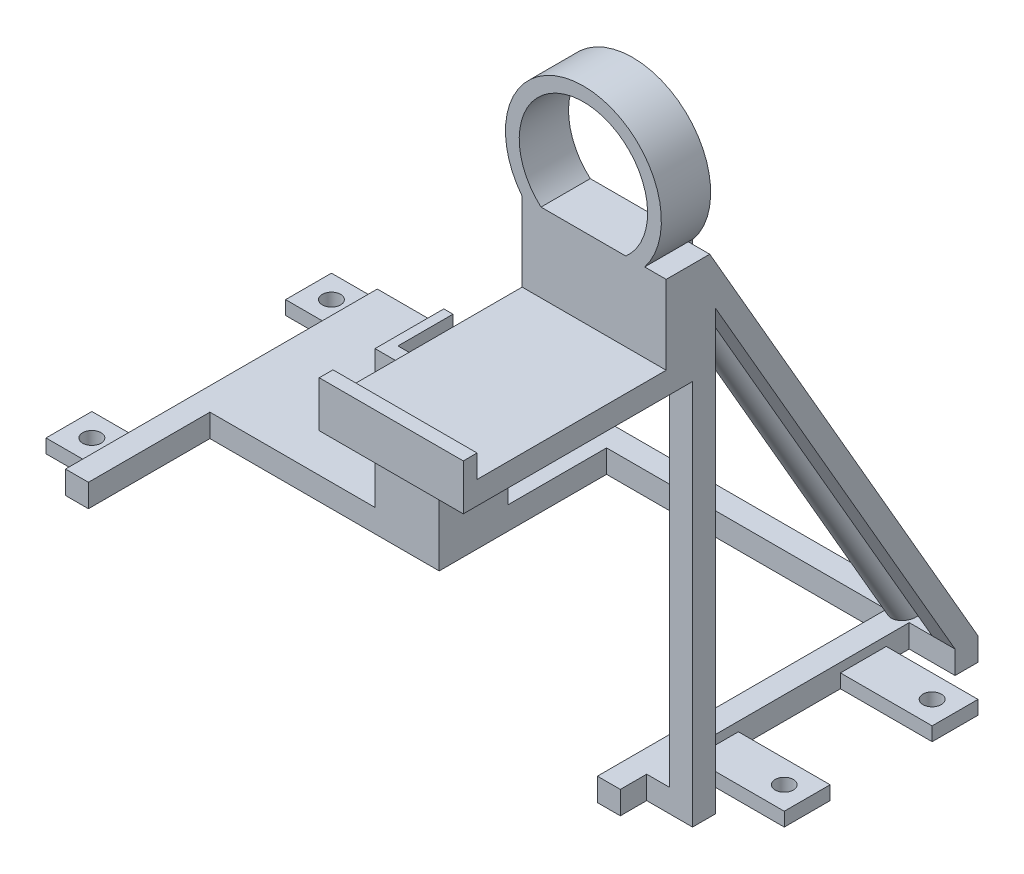
from build123d import *
from OCP.BRepAlgoAPI import BRepAlgoAPI_Cut
from OCP.TopTools import TopTools_ListOfShape

# Parameters (mm, degrees)
BOSS_EXTRUDE1_DEPTH              = 5
SKETCH2_R                        = 2.5
BOSS_EXTRUDE2_DEPTH              = 100
SKETCH3_W                        = 5
SKETCH3_H                        = 5
BOSS_EXTRUDE3_DEPTH              = 10
SKETCH5_W                        = 5
SKETCH5_H                        = 4.330127019
BOSS_EXTRUDE4_DEPTH              = 117
SKETCH6_W                        = 5
SKETCH6_H                        = 5
BOSS_EXTRUDE5_DEPTH              = 20
BOSS_EXTRUDE6_DEPTH              = 15
SKETCH9_W                        = 5
SKETCH9_H                        = 5
BOSS_EXTRUDE7_DEPTH              = 10
SKETCH10_W                       = 5
SKETCH10_H                       = 5
BOSS_EXTRUDE8_DEPTH              = 99.159909
SKETCH11_W                       = 10
SKETCH11_H                       = 3
BOSS_EXTRUDE9_DEPTH              = 10
CUT_EXTRUDE1_DEPTH               = 187.084790711
CUT_EXTRUDE1_DEPTH_BACK          = 187.084790711
SKETCH13_R                       = 2
SKETCH14_W                       = 10
SKETCH14_H                       = 3
BOSS_EXTRUDE10_DEPTH             = 20
CUT_EXTRUDE2_DEPTH               = 194.255140511
CUT_EXTRUDE2_DEPTH_BACK          = 194.255140511
SKETCH15_R                       = 2
BOSS_EXTRUDE11_DEPTH             = 7.8
CUT_EXTRUDE3_DEPTH               = 187.016127587
CUT_EXTRUDE3_DEPTH_BACK          = 187.016127587
SKETCH17_W                       = 22.17902444
SKETCH17_H                       = 20
BOSS_EXTRUDE12_DEPTH             = 5.75
BOSS_EXTRUDE12_DEPTH_BACK        = 5
SKETCH19_W                       = 1.5
SKETCH19_H                       = 10.75
BOSS_EXTRUDE13_DEPTH             = 2.742414
SKETCH21_W                       = 1.5
SKETCH21_H                       = 1
BOSS_EXTRUDE15_DEPTH             = 1
BOSS_EXTRUDE17_REACH             = 195.512
CUT_EXTRUDE4_START               = 2
SKETCH23_W                       = 7.8
SKETCH23_H                       = 12
CUT_EXTRUDE4_DEPTH               = 10
BOSS_EXTRUDE19_DEPTH             = 5
BOSS_EXTRUDE19_DEPTH_BACK        = 2.165064
SKETCH23_2_W                     = 7.8
SKETCH23_2_H                     = 12
CUT_EXTRUDE5_DEPTH               = 1.25
BOSS_EXTRUDE20_REACH             = 188.016
SKETCH25_W                       = 5
SKETCH25_H                       = 4.330127019
SKETCH26_W                       = 5
SKETCH26_H                       = 2.16506351
CUT_EXTRUDE6_DEPTH               = 5
SKETCH27_W                       = 5.75
SKETCH27_H                       = 7.16506351
BOSS_EXTRUDE21_DEPTH             = 5
SKETCH29_W                       = 3
SKETCH29_H                       = 30
BOSS_EXTRUDE22_DEPTH             = 55
SKETCH30_W                       = 5
SKETCH30_H                       = 3
BOSS_EXTRUDE23_DEPTH             = 5
SKETCH31_W                       = 5
SKETCH31_H                       = 5
BOSS_EXTRUDE24_DEPTH             = 33.5
SKETCH32_W                       = 2
SKETCH32_H                       = 19
BOSS_EXTRUDE25_DEPTH             = 12
SKETCH34_W                       = 41
SKETCH34_H                       = 3
CUT_EXTRUDE7_DEPTH               = 30
SKETCH35_W                       = 14
SKETCH35_H                       = 12
BOSS_EXTRUDE26_DEPTH             = 7
BOSS_EXTRUDE27_REACH             = 187.154
SKETCH36_W                       = 9
SKETCH36_H                       = 5
BOSS_EXTRUDE27_DIRECTION_2_REACH = 187.154
SKETCH37_W                       = 41.5
SKETCH37_H                       = 5
BOSS_EXTRUDE28_DEPTH             = 41
SKETCH38_W                       = 34.251665069
SKETCH38_H                       = 27.087918127
CUT_EXTRUDE8_DEPTH               = 185.330721404
SKETCH39_W                       = 67.684653824
SKETCH39_H                       = 30.030202731
CUT_EXTRUDE9_DEPTH               = 190.235302527
SKETCH44_W                       = 5
SKETCH44_H                       = 7.16506351
BOSS_EXTRUDE30_DEPTH             = 18.612596
BOSS_EXTRUDE31_DEPTH             = 10.75
BOSS_EXTRUDE32_DEPTH             = 5.75
SKETCH46_W                       = 5
SKETCH46_H                       = 5
EDIT_THIS_LENGTH_DEPTH           = 50
SKETCH47_W                       = 5
SKETCH47_H                       = 3
BOSS_EXTRUDE34_DEPTH             = 5
BOSS_EXTRUDE35_REACH             = 207.703
SKETCH48_W                       = 26.412596329
SKETCH48_H                       = 5.25
SKETCH50_W                       = 5
SKETCH50_H                       = 5.75
BOSS_EXTRUDE36_DEPTH             = 10
BOSS_EXTRUDE37_DEPTH             = 26.412596329
CHAMFER1_SIZE                    = 16
CHAMFER1_SIZE2                   = 1.399818616


with BuildPart() as part:
    # Sketch1 → Boss-Extrude1 (new body)
    with BuildSketch(Plane(origin=(0, 0, 0), x_dir=(1, 0, 0), z_dir=(0, 1, 0))):
        Polygon((121, 0), (0, 0), (0, -68), (5, -68), (5, -5), (116, -5), (116, -68), (121, -68), align=None)
    extrude(amount=BOSS_EXTRUDE1_DEPTH)

    # Sketch2 → Boss-Extrude2 (add)
    with BuildSketch(Plane(origin=(0, 3.75, 2.165063509), x_dir=(1, 0, 0), z_dir=(0, 0.866025403784438, 0.500000000000001))):
        with Locations(Location((118.200131686, -0.299868314, 0), (0, 0, 90))):
            Circle(SKETCH2_R)
    extrude(amount=BOSS_EXTRUDE2_DEPTH)

    # Sketch3 → Boss-Extrude3 (add)
    with BuildSketch(Plane(origin=(121, 0, 0), x_dir=(0, 0, -1), z_dir=(1, 0, 0))):
        with Locations((-2.5, 2.5)):
            Rectangle(SKETCH3_W, SKETCH3_H)
    extrude(amount=BOSS_EXTRUDE3_DEPTH)

    # Sketch5 → Boss-Extrude4 (add)
    with BuildSketch(Plane(origin=(0, 3.75, 2.165063509), x_dir=(1, 0, 0), z_dir=(0, 0.866025403784438, 0.500000000000001))):
        with Locations((128.5, 0.33493649)):
            Rectangle(SKETCH5_W, SKETCH5_H)
    extrude(amount=BOSS_EXTRUDE4_DEPTH)

    # Sketch6 → Boss-Extrude5 (add)
    with BuildSketch(Plane(origin=(0, 1.25, -2.165063509), x_dir=(-1, 0, 0), z_dir=(0, 0.5000000000000009, -0.866025403784438))):
        with Locations((-128.5, 118.830127019)):
            Rectangle(SKETCH6_W, SKETCH6_H)
    extrude(amount=BOSS_EXTRUDE5_DEPTH)

    # Sketch7 → Boss-Extrude6 (add)
    with BuildSketch(Plane.ZY.offset(-126)):
        Polygon((45.509618943, 113.824972243), (41.179491924, 116.324972243), (38.679491924, 111.994845224), (43.009618943, 109.494845224), align=None)
    extrude(amount=BOSS_EXTRUDE6_DEPTH)

    # Sketch9 → Boss-Extrude7 (add)
    with BuildSketch(Plane(origin=(121, 0, 0), x_dir=(0, 0, -1), z_dir=(1, 0, 0))):
        with Locations((-59.75, 2.5)):
            Rectangle(SKETCH9_W, SKETCH9_H)
    extrude(amount=BOSS_EXTRUDE7_DEPTH)

    # Sketch10 → Boss-Extrude8 (add)
    with BuildSketch(Plane(origin=(0, 5, 0), x_dir=(1, 0, 0), z_dir=(0, 1, 0))):
        with Locations((128.5, -59.75)):
            Rectangle(SKETCH10_W, SKETCH10_H)
    extrude(amount=BOSS_EXTRUDE8_DEPTH)

    # Sketch11 → Boss-Extrude9 (add)
    with BuildSketch(Plane.ZY):
        with Locations((57.25, 1.5)):
            Rectangle(SKETCH11_W, SKETCH11_H)
        with Locations((5, 1.5)):
            Rectangle(SKETCH11_W, SKETCH11_H)
    extrude(amount=BOSS_EXTRUDE9_DEPTH)

    # Sketch13 → Cut-Extrude1 (cut, two sides: drawn at the far end of the back side and taken through both)
    with BuildSketch(Plane(origin=(0, 3, 0), x_dir=(1, 0, 0), z_dir=(0, 1, 0)).offset(-CUT_EXTRUDE1_DEPTH_BACK)):
        with Locations(Location((-5, -5, 0), (0, 0, 270))):
            Circle(SKETCH13_R)
        with Locations(Location((-5, -57.25, 0), (0, 0, 270))):
            Circle(SKETCH13_R)
    extrude(amount=CUT_EXTRUDE1_DEPTH + CUT_EXTRUDE1_DEPTH_BACK, mode=Mode.SUBTRACT)

    # Sketch14 → Boss-Extrude10 (add)
    with BuildSketch(Plane(origin=(121, 0, 0), x_dir=(0, 0, -1), z_dir=(1, 0, 0))):
        with Locations((-15, 1.5)):
            Rectangle(SKETCH14_W, SKETCH14_H)
        with Locations((-47.25, 1.5)):
            Rectangle(SKETCH14_W, SKETCH14_H)
    extrude(amount=BOSS_EXTRUDE10_DEPTH)

    # Sketch15 → Cut-Extrude2 (cut, two sides: drawn at the far end of the back side and taken through both)
    with BuildSketch(Plane(origin=(0, 3, 0), x_dir=(1, 0, 0), z_dir=(0, 1, 0)).offset(-CUT_EXTRUDE2_DEPTH_BACK)):
        with Locations(Location((136, -15, 0), (0, 0, 270))):
            Circle(SKETCH15_R)
        with Locations(Location((136, -47.25, 0), (0, 0, 270))):
            Circle(SKETCH15_R)
    extrude(amount=CUT_EXTRUDE2_DEPTH + CUT_EXTRUDE2_DEPTH_BACK, mode=Mode.SUBTRACT)

    # Sketch16 → Boss-Extrude11 (add)
    with BuildSketch(Plane.ZY.offset(-126)):
        Polygon((49.839745962, 111.324972243), (67, 101.417494955), (64.5, 97.087367936), (47.339745962, 106.994845224), align=None)
    extrude(amount=BOSS_EXTRUDE11_DEPTH)

    # Sketch17 → Cut-Extrude3 (cut, two sides: drawn at the far end of the back side and taken through both)
    with BuildSketch(Plane(origin=(0, 105.074972243, 60.665063509), x_dir=(1, 0, 0), z_dir=(0, 0.8660254037844382, 0.500000000000001)).offset(-CUT_EXTRUDE3_DEPTH_BACK)):
        with Locations((119.91048778, 12.5)):
            Rectangle(SKETCH17_W, SKETCH17_H)
    extrude(amount=CUT_EXTRUDE3_DEPTH + CUT_EXTRUDE3_DEPTH_BACK, mode=Mode.SUBTRACT)



with BuildPart() as body_2:
    # Sketch18 → Boss-Extrude12 (new, two sides: drawn at the far end of the back side and taken through both)
    with BuildSketch(Plane.XY.offset(62.25).offset(-BOSS_EXTRUDE12_DEPTH_BACK)):
        with BuildLine():
            Line((118.2, 104.159908733), (119.7, 104.159908733))
            ThreePointArc((119.7, 104.159908733), (110.2, 113.659908733), (100.7, 104.159908733))
            Line((100.7, 104.159908733), (102.2, 104.159908733))
            ThreePointArc((102.2, 104.159908733), (110.2, 112.159908733), (118.2, 104.159908733))
        make_face()
    extrude(amount=BOSS_EXTRUDE12_DEPTH + BOSS_EXTRUDE12_DEPTH_BACK)


with BuildPart() as part_1:
    add(part.part)

    add(body_2.part)  # Boss-Extrude13 merges body 2
    # Sketch19 → Boss-Extrude13 (add)
    with BuildSketch(Plane.XZ.offset(-104.159908733)):
        with Locations((118.95, 62.625)):
            Rectangle(SKETCH19_W, SKETCH19_H)
    extrude(amount=BOSS_EXTRUDE13_DEPTH)

    # Sketch21 → Boss-Extrude15 (add)
    with BuildSketch(Plane.XZ.offset(-101.417494955)):
        with Locations((118.95, 67.5)):
            Rectangle(SKETCH21_W, SKETCH21_H)
    extrude(amount=BOSS_EXTRUDE15_DEPTH)

    # Boss-Extrude17: up to this plane
    boss_extrude17_end = Plane(origin=(119.7, 101.417494955, 68), z_dir=(0, 0, -1))
    # Sketch20 → Boss-Extrude17 (add, up to the surface)
    with BuildSketch(Plane(origin=(0, -3.657477288, 6.334936491), x_dir=(1, 0, 0), z_dir=(0, -0.5000000000000039, 0.8660254037844365)), mode=Mode.PRIVATE) as boss_extrude17_sk1:
        Polygon((126, 116.330127019), (126, 121.330127019), (119.7, 121.330127019), (118.2, 121.330127019), (118.2, 116.330127019), align=None)
    boss_extrude17_tool1 = split(extrude(boss_extrude17_sk1.sketch, amount=BOSS_EXTRUDE17_REACH, mode=Mode.PRIVATE), bisect_by=boss_extrude17_end, keep=Keep.BOTH, mode=Mode.PRIVATE)
    add(boss_extrude17_tool1.solids().sort_by_distance((122.1, 99.252431, 65.75))[0])

    # Sketch23 → Cut-Extrude4 (cut)
    with BuildSketch(Plane(origin=(0, 104.159908733, 0), x_dir=(-1, 0, 0), z_dir=(0, -1, 0)).offset(CUT_EXTRUDE4_START)):
        with Locations((-122.1, -62)):
            Rectangle(SKETCH23_W, SKETCH23_H)
    extrude(amount=CUT_EXTRUDE4_DEPTH, mode=Mode.SUBTRACT)

    # Sketch23<2> → Boss-Extrude19 (add, two sides: drawn at the far end of the back side and taken through both)
    with BuildSketch(Plane(origin=(0, 104.159908733, 0), x_dir=(-1, 0, 0), z_dir=(0, -1, 0)).offset(-BOSS_EXTRUDE19_DEPTH_BACK)):
        with Locations((-122.1, -62)):
            Rectangle(SKETCH23_2_W, SKETCH23_2_H)
    extrude(amount=BOSS_EXTRUDE19_DEPTH + BOSS_EXTRUDE19_DEPTH_BACK)


with BuildPart() as cut_extrude5_tool:
    # Sketch24 → Cut-Extrude5 (new body)
    with BuildSketch(Plane(origin=(0, 0, 56), x_dir=(-1, 0, 0), z_dir=(0, 0, -1))):
        Polygon((-126, 106.324972243), (-126, 101.994845224), (-126, 99.159908733), (-118.2, 99.159908733), (-118.2, 106.324972243), align=None)
    extrude(amount=-CUT_EXTRUDE5_DEPTH)


with BuildPart() as part_2:
    add(part_1.part)

    # Cut-Extrude5: cut by cut_extrude5_tool, with a tolerance
    cut_extrude5_stock = TopTools_ListOfShape()
    cut_extrude5_stock.Append(part_2.part.wrapped)
    cut_extrude5_tools = TopTools_ListOfShape()
    cut_extrude5_tools.Append(cut_extrude5_tool.part.wrapped)
    cut_extrude5_cut = BRepAlgoAPI_Cut()
    cut_extrude5_cut.SetArguments(cut_extrude5_stock)
    cut_extrude5_cut.SetTools(cut_extrude5_tools)
    cut_extrude5_cut.SetFuzzyValue(0.00001)
    cut_extrude5_cut.Build()
    add(Compound.cast(cut_extrude5_cut.Shape()).solids(), mode=Mode.REPLACE)

    # Boss-Extrude20: up to this face of the body (flat: up to its plane)
    boss_extrude20_end = Plane(part_2.part.faces().sort_by_distance((122.724999943, 106.324972733, 62.625))[0])
    # Sketch25 → Boss-Extrude20 (add, up to the picked face)
    with BuildSketch(Plane(origin=(0, 105.074972243, 60.665063509), x_dir=(1, 0, 0), z_dir=(0, 0.8660254037844382, 0.500000000000001)), mode=Mode.PRIVATE) as boss_extrude20_sk1:
        with Locations((128.5, 0.33493649)):
            Rectangle(SKETCH25_W, SKETCH25_H)
    boss_extrude20_tool1 = split(extrude(boss_extrude20_sk1.sketch, amount=BOSS_EXTRUDE20_REACH, mode=Mode.PRIVATE), bisect_by=boss_extrude20_end, keep=Keep.BOTH, mode=Mode.PRIVATE)
    add(boss_extrude20_tool1.solids().sort_by(Axis((128.5, 105.24244, 60.375), (0, 0.8660254037844382, 0.500000000000001)))[0])


with BuildPart() as cut_extrude6_tool:
    # Sketch26 → Cut-Extrude6 (new body)
    with BuildSketch(Plane.XY.offset(62.25)):
        with Locations((128.5, 105.242440488)):
            Rectangle(SKETCH26_W, SKETCH26_H)
    extrude(amount=CUT_EXTRUDE6_DEPTH)


with BuildPart() as part_3:
    add(part_2.part)

    # Cut-Extrude6: cut by cut_extrude6_tool, with a tolerance
    cut_extrude6_stock = TopTools_ListOfShape()
    cut_extrude6_stock.Append(part_3.part.wrapped)
    cut_extrude6_tools = TopTools_ListOfShape()
    cut_extrude6_tools.Append(cut_extrude6_tool.part.wrapped)
    cut_extrude6_cut = BRepAlgoAPI_Cut()
    cut_extrude6_cut.SetArguments(cut_extrude6_stock)
    cut_extrude6_cut.SetTools(cut_extrude6_tools)
    cut_extrude6_cut.SetFuzzyValue(0.00001)
    cut_extrude6_cut.Build()
    add(Compound.cast(cut_extrude6_cut.Shape()).solids(), mode=Mode.REPLACE)

    # Sketch27 → Boss-Extrude21 (add)
    with BuildSketch(Plane(origin=(126, 0, 0), x_dir=(0, 0, -1), z_dir=(1, 0, 0))):
        with Locations((-65.125, 102.742440488)):
            Rectangle(SKETCH27_W, SKETCH27_H)
    extrude(amount=BOSS_EXTRUDE21_DEPTH)

    # Sketch29 → Boss-Extrude22 (add)
    with BuildSketch(Plane.ZY):
        with Locations((40, 20)):
            Rectangle(SKETCH29_W, SKETCH29_H)
    extrude(amount=-BOSS_EXTRUDE22_DEPTH)

    # Sketch30 → Boss-Extrude23 (add)
    with BuildSketch(Plane.XZ.offset(-5)):
        with Locations((52.5, 40)):
            Rectangle(SKETCH30_W, SKETCH30_H)
    extrude(amount=BOSS_EXTRUDE23_DEPTH)

    # Sketch31 → Boss-Extrude24 (add)
    with BuildSketch(Plane(origin=(0, 0, 38.5), x_dir=(-1, 0, 0), z_dir=(0, 0, -1))):
        with Locations((-52.5, 2.5)):
            Rectangle(SKETCH31_W, SKETCH31_H)
    extrude(amount=BOSS_EXTRUDE24_DEPTH)

    # Sketch32 → Boss-Extrude25 (add)
    with BuildSketch(Plane(origin=(0, 0, 38.5), x_dir=(-1, 0, 0), z_dir=(0, 0, -1))):
        Polygon((-41, 9), (-53, 9), (-53, 35), (-55, 35), (-55, 7), (-41, 7), align=None)
        with Locations((-42, 25.5)):
            Rectangle(SKETCH32_W, SKETCH32_H)
    extrude(amount=BOSS_EXTRUDE25_DEPTH)

    # Sketch34 → Cut-Extrude7 (cut)
    with BuildSketch(Plane(origin=(0, 35, 0), x_dir=(1, 0, 0), z_dir=(0, 1, 0))):
        with Locations((20.5, -40)):
            Rectangle(SKETCH34_W, SKETCH34_H)
    extrude(amount=-CUT_EXTRUDE7_DEPTH, mode=Mode.SUBTRACT)

    # Sketch35 → Boss-Extrude26 (add)
    with BuildSketch(Plane.XZ.offset(-7)):
        with Locations((48, 32.5)):
            Rectangle(SKETCH35_W, SKETCH35_H)
    extrude(amount=BOSS_EXTRUDE26_DEPTH)

    # Boss-Extrude27: up to this face of the body (flat: up to its plane)
    boss_extrude27_end = Plane(part_3.part.faces().sort_by_distance((48.252808989, 19.016853933, 41.5))[0])
    # Sketch36 → Boss-Extrude27 (add, up to the picked face)
    with BuildSketch(Plane.XY.offset(38.5), mode=Mode.PRIVATE) as boss_extrude27_sk1:
        with Locations((45.5, 2.5)):
            Rectangle(SKETCH36_W, SKETCH36_H)
    boss_extrude27_tool1 = split(extrude(boss_extrude27_sk1.sketch, amount=BOSS_EXTRUDE27_REACH, mode=Mode.PRIVATE), bisect_by=boss_extrude27_end, keep=Keep.BOTH, mode=Mode.PRIVATE)
    add(boss_extrude27_tool1.solids().sort_by(Axis((45.5, 2.5, 38.5), (0, 0, 1)))[0])

    # Boss-Extrude27 direction 2: up to this face of the body (flat: up to its plane)
    boss_extrude27_direction_2_end = Plane(part_3.part.faces().sort_by_distance((27.5, 2.5, 5))[0])
    # Sketch36 → Boss-Extrude27 direction 2 (add, up to the picked face)
    with BuildSketch(Plane.XY.offset(38.5), mode=Mode.PRIVATE) as boss_extrude27_direction_2_sk1:
        with Locations((45.5, 2.5)):
            Rectangle(SKETCH36_W, SKETCH36_H)
    boss_extrude27_direction_2_tool1 = split(extrude(boss_extrude27_direction_2_sk1.sketch, amount=-BOSS_EXTRUDE27_DIRECTION_2_REACH, mode=Mode.PRIVATE), bisect_by=boss_extrude27_direction_2_end, keep=Keep.BOTH, mode=Mode.PRIVATE)
    add(boss_extrude27_direction_2_tool1.solids().sort_by(Axis((45.5, 2.5, 38.5), (0, 0, -1)))[0])

    # Sketch37 → Boss-Extrude28 (add)
    with BuildSketch(Plane.ZY.offset(-41)):
        with Locations((20.75, 2.5)):
            Rectangle(SKETCH37_W, SKETCH37_H)
    extrude(amount=BOSS_EXTRUDE28_DEPTH)

    # Sketch38 → Cut-Extrude8 (cut, through all)
    with BuildSketch(Plane.ZY.offset(-118.2)):
        with Locations((61.183105348, 109.662346151)):
            Rectangle(SKETCH38_W, SKETCH38_H)
    extrude(amount=CUT_EXTRUDE8_DEPTH, mode=Mode.SUBTRACT)

    # Sketch39 → Cut-Extrude9 (cut, through all)
    with BuildSketch(Plane(origin=(0, 106.324972243, 0), x_dir=(1, 0, 0), z_dir=(0, 1, 0))):
        with Locations((120.498501698, -57.225220953)):
            Rectangle(SKETCH39_W, SKETCH39_H)
    extrude(amount=CUT_EXTRUDE9_DEPTH, mode=Mode.SUBTRACT)

    # Sketch44 → Boss-Extrude30 (add)
    with BuildSketch(Plane.ZY.offset(-118.2)):
        with Locations((59.75, 102.742440488)):
            Rectangle(SKETCH44_W, SKETCH44_H)
    extrude(amount=BOSS_EXTRUDE30_DEPTH)

    # Sketch43 → Boss-Extrude31 (add)
    with BuildSketch(Plane(origin=(0, 0, 57.25), x_dir=(-1, 0, 0), z_dir=(0, 0, -1))):
        with BuildLine():
            Line((-122.200131686, 106.324972243), (-126, 106.324972243))
            Line((-126, 106.324972243), (-126.312859701, 106.324972243))
            ThreePointArc((-126.312859701, 106.324972243), (-112.950131686, 133.833897021), (-99.587403671, 106.324972243))
            Line((-99.587403671, 106.324972243), (-103.700131686, 106.324972243))
            ThreePointArc((-103.700131686, 106.324972243), (-112.950131686, 130.833897021), (-122.200131686, 106.324972243))
        make_face()
    extrude(amount=-BOSS_EXTRUDE31_DEPTH)

    # Sketch45 → Boss-Extrude32 (add)
    with BuildSketch(Plane.XY.offset(62.25)):
        Polygon((118.2, 99.159908733), (118.2, 106.324972243), (103.700131686, 106.324972243), (99.587403671, 106.324972243), (99.587403671, 99.159908733), align=None)
    extrude(amount=BOSS_EXTRUDE32_DEPTH)

    # Sketch46 → EDIT THIS LENGTH (add)
    with BuildSketch(Plane.XY.offset(62.25)):
        with Locations((128.5, 86.659908733)):
            Rectangle(SKETCH46_W, SKETCH46_H)
    extrude(amount=EDIT_THIS_LENGTH_DEPTH)

    # Sketch47 → Boss-Extrude34 (add)
    with BuildSketch(Plane(origin=(0, 89.159908733, 0), x_dir=(1, 0, 0), z_dir=(0, 1, 0))):
        with Locations((128.5, -110.75)):
            Rectangle(SKETCH47_W, SKETCH47_H)
    extrude(amount=BOSS_EXTRUDE34_DEPTH)

    # Boss-Extrude35: up to this face of the body (flat: up to its plane)
    boss_extrude35_end = Plane(part_3.part.faces().sort_by_distance((128.5, 84.159908733, 87.25))[0])
    # Sketch48 → Boss-Extrude35 (add, up to the picked face)
    with BuildSketch(Plane.XZ.offset(-99.159908733), mode=Mode.PRIVATE) as boss_extrude35_sk1:
        with Locations((112.793701836, 65.375)):
            Rectangle(SKETCH48_W, SKETCH48_H)
    boss_extrude35_tool1 = split(extrude(boss_extrude35_sk1.sketch, amount=BOSS_EXTRUDE35_REACH, mode=Mode.PRIVATE), bisect_by=boss_extrude35_end, keep=Keep.BOTH, mode=Mode.PRIVATE)
    add(boss_extrude35_tool1.solids().sort_by(Axis((112.793702, 99.159909, 65.375), (0, -1, 0)))[0])

    # Sketch50 → Boss-Extrude36 (add)
    with BuildSketch(Plane.XZ.offset(-99.159908733)):
        with Locations((128.5, 65.125)):
            Rectangle(SKETCH50_W, SKETCH50_H)
    extrude(amount=BOSS_EXTRUDE36_DEPTH)

    # Sketch51 → Boss-Extrude37 (add)
    with BuildSketch(Plane.ZY.offset(-126)):
        Polygon((68, 89.159908733), (68, 84.159908733), (112.25, 84.159908733), (112.25, 94.159908733), (109.25, 94.159908733), (109.25, 89.159908733), align=None)
    extrude(amount=BOSS_EXTRUDE37_DEPTH)

    # Chamfer1
    chamfer1_edges = [part_3.edges().sort_by_distance(p)[0] for p in [
        (99.587404, 99.159908733, 59.75),
    ]]
    chamfer1_side = [part_3.faces().sort_by_distance(p)[0] for p in [
        (112.793702, 99.159908733, 60),
    ]]
    chamfer(chamfer1_edges, length=CHAMFER1_SIZE, length2=CHAMFER1_SIZE2, reference=chamfer1_side[0])


solid = part_3.part
